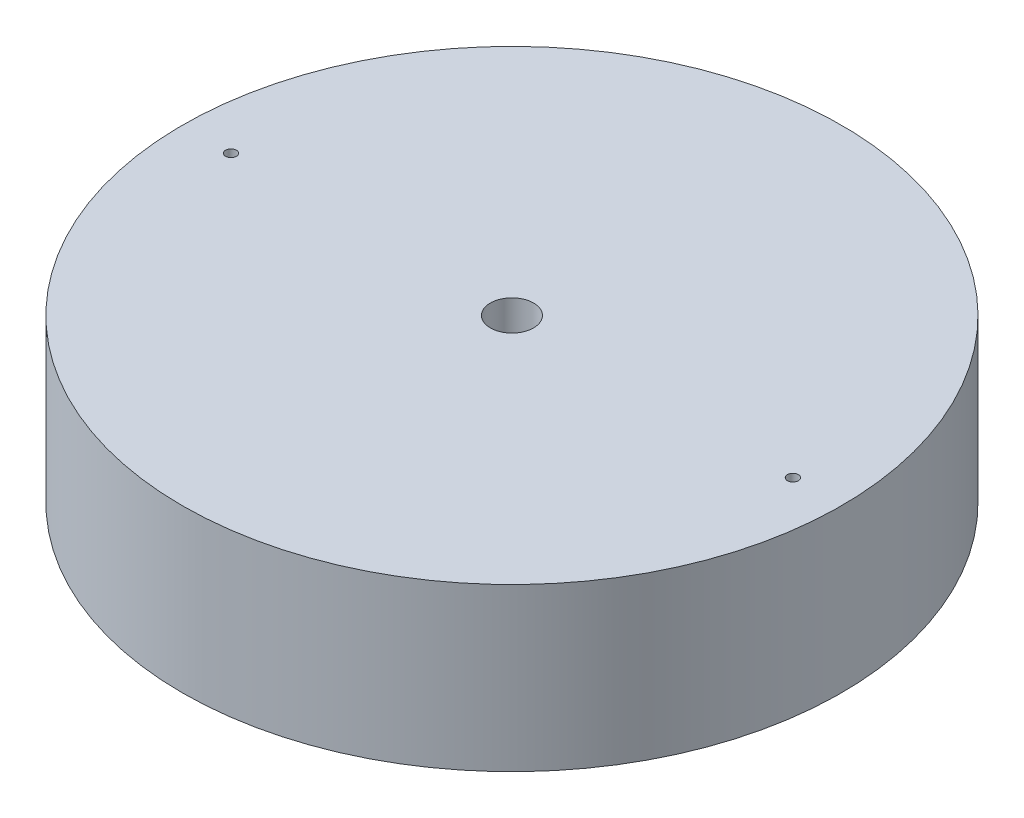
from build123d import *

# Parameters (mm, degrees)
SKETCH1_R           = 32.5
BOSS_EXTRUDE1_DEPTH = 15
CUT_EXTRUDE2_START  = -30
SKETCH2_R           = 32.5
SKETCH2_R_2         = 30.5
CUT_EXTRUDE2_DEPTH  = 30
SKETCH3_R           = 28
SKETCH3_R_2         = 24
CUT_EXTRUDE3_DEPTH  = 7
SKETCH5_R           = 0.5
CUT_EXTRUDE5_DEPTH  = 46.667274935
SKETCH6_R           = 2
CUT_EXTRUDE6_DEPTH  = 46.667274935


with BuildPart() as part:
    # Sketch1 → Boss-Extrude1 (new body)
    with BuildSketch(Plane(origin=(0, 0, 0), x_dir=(1, 0, 0), z_dir=(0, 1, 0))):
        Circle(SKETCH1_R)
    extrude(amount=BOSS_EXTRUDE1_DEPTH)

    # Sketch2 → Cut-Extrude2 (cut)
    with BuildSketch(Plane(origin=(0, 15, 0), x_dir=(1, 0, 0), z_dir=(0, 1, 0)).offset(CUT_EXTRUDE2_START)):
        Circle(SKETCH2_R)
        Circle(SKETCH2_R_2, mode=Mode.SUBTRACT)
    extrude(amount=CUT_EXTRUDE2_DEPTH, mode=Mode.SUBTRACT)

    # Sketch3 → Cut-Extrude3 (cut)
    with BuildSketch(Plane.XZ):
        Circle(SKETCH3_R)
        Circle(SKETCH3_R_2, mode=Mode.SUBTRACT)
    extrude(amount=-CUT_EXTRUDE3_DEPTH, mode=Mode.SUBTRACT)

    # Sketch5 → Cut-Extrude5 (cut, through all)
    with BuildSketch(Plane(origin=(0, 15, 0), x_dir=(1, 0, 0), z_dir=(0, 1, 0))):
        with Locations((-26, 0)):
            Circle(SKETCH5_R)
        with Locations((26, 0)):
            Circle(SKETCH5_R)
    extrude(amount=-CUT_EXTRUDE5_DEPTH, mode=Mode.SUBTRACT)

    # Sketch6 → Cut-Extrude6 (cut, through all)
    with BuildSketch(Plane(origin=(0, 15, 0), x_dir=(1, 0, 0), z_dir=(0, 1, 0))):
        Circle(SKETCH6_R)
    extrude(amount=-CUT_EXTRUDE6_DEPTH, mode=Mode.SUBTRACT)


solid = part.part
